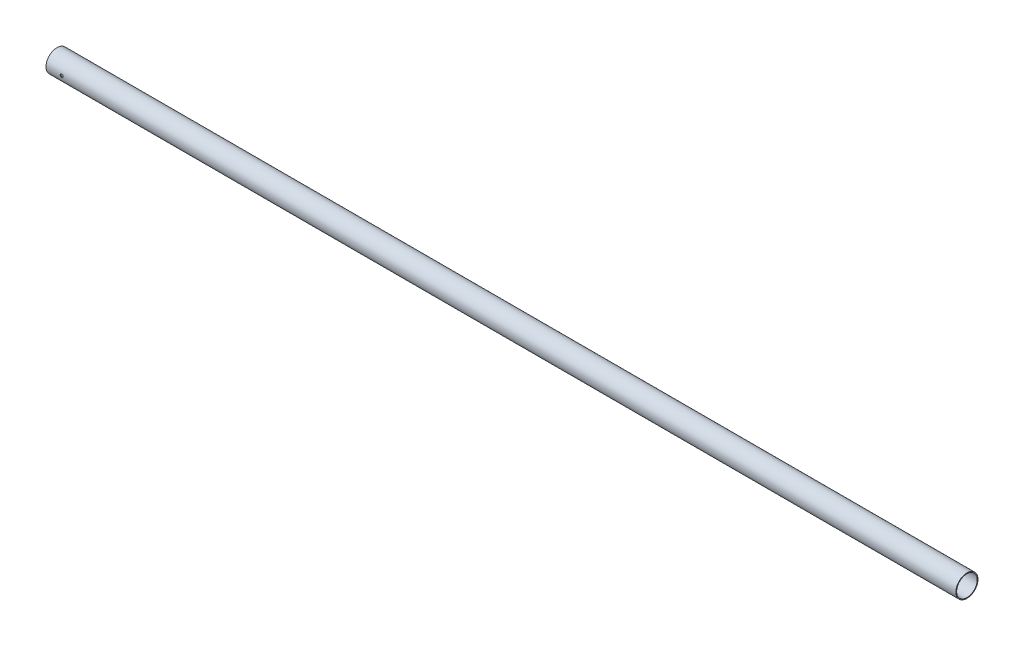
from build123d import *

# Parameters (mm, degrees)
SKETCH1_R               = 12.7
SKETCH1_R_2             = 11.811
BOSS_EXTRUDE1_DEPTH     = 1043.702
CUT_EXTRUDE1_DEPTH      = 1044.856525009
CUT_EXTRUDE1_DEPTH_BACK = 1044.856525009
SKETCH2_R               = 1.7


with BuildPart() as part:
    # Sketch1 → Boss-Extrude1 (new body)
    with BuildSketch(Plane(origin=(0, 0, 0), x_dir=(0, 0, -1), z_dir=(1, 0, 0))):
        Circle(SKETCH1_R)
        Circle(SKETCH1_R_2, mode=Mode.SUBTRACT)
    extrude(amount=BOSS_EXTRUDE1_DEPTH)

    # Sketch2 → Cut-Extrude1 (cut, two sides: drawn at the far end of the back side and taken through both)
    with BuildSketch(Plane.XY.offset(-CUT_EXTRUDE1_DEPTH_BACK)):
        with Locations((18, 0)):
            Circle(SKETCH2_R)
    extrude(amount=CUT_EXTRUDE1_DEPTH + CUT_EXTRUDE1_DEPTH_BACK, mode=Mode.SUBTRACT)


solid = part.part
